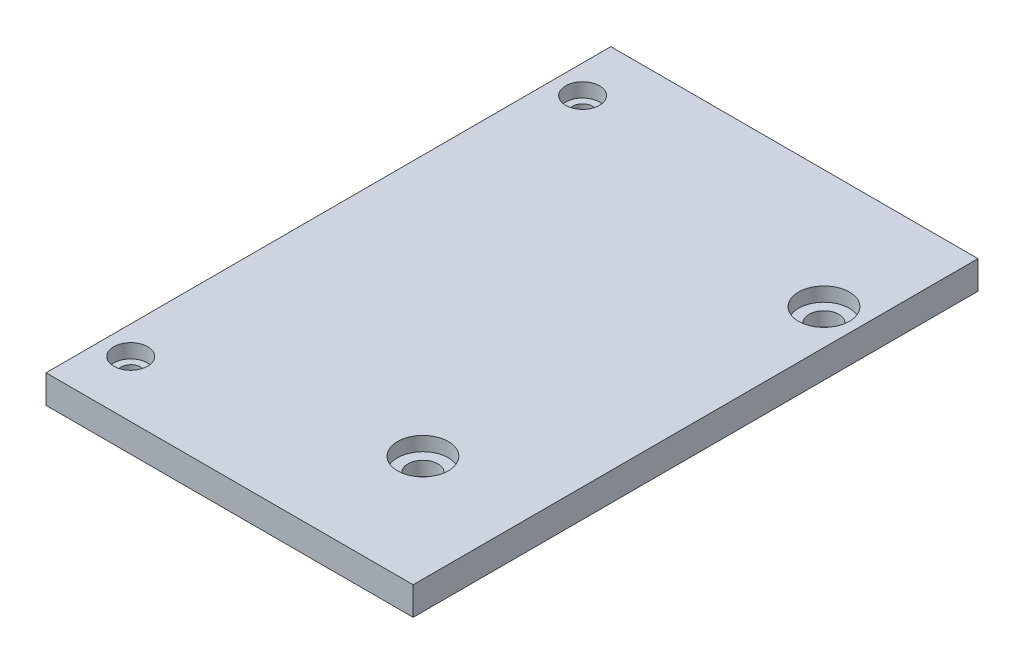
from build123d import *

# Parameters (mm, degrees)
SKETCH2_W           = 65
SKETCH2_H           = 100
SKETCH2_R           = 1.75
SKETCH2_R_2         = 2.65
BOSS_EXTRUDE1_DEPTH = 5
SKETCH3_R           = 4.5
SKETCH3_R_2         = 3
CUT_EXTRUDE1_DEPTH  = 2.5


with BuildPart() as part:
    # Sketch2 → Boss-Extrude1 (new body)
    with BuildSketch(Plane(origin=(0, 0, 0), x_dir=(1, 0, 0), z_dir=(0, 1, 0))):
        Rectangle(SKETCH2_W, SKETCH2_H)
        with Locations((-27.5, 40)):
            Circle(SKETCH2_R, mode=Mode.SUBTRACT)
        with Locations((-27.5, -40)):
            Circle(SKETCH2_R, mode=Mode.SUBTRACT)
        with Locations((26.23, 29)):
            Circle(SKETCH2_R_2, mode=Mode.SUBTRACT)
        with Locations((13.65, -29.42)):
            Circle(SKETCH2_R_2, mode=Mode.SUBTRACT)
    extrude(amount=BOSS_EXTRUDE1_DEPTH)

    # Sketch3 → Cut-Extrude1 (cut)
    with BuildSketch(Plane(origin=(0, 5, 0), x_dir=(1, 0, 0), z_dir=(0, 1, 0))):
        with Locations((26.23, 29)):
            Circle(SKETCH3_R)
        with Locations((13.65, -29.42)):
            Circle(SKETCH3_R)
        with Locations((-27.5, 40)):
            Circle(SKETCH3_R_2)
        with Locations((-27.5, -40)):
            Circle(SKETCH3_R_2)
    extrude(amount=-CUT_EXTRUDE1_DEPTH, mode=Mode.SUBTRACT)


solid = part.part
